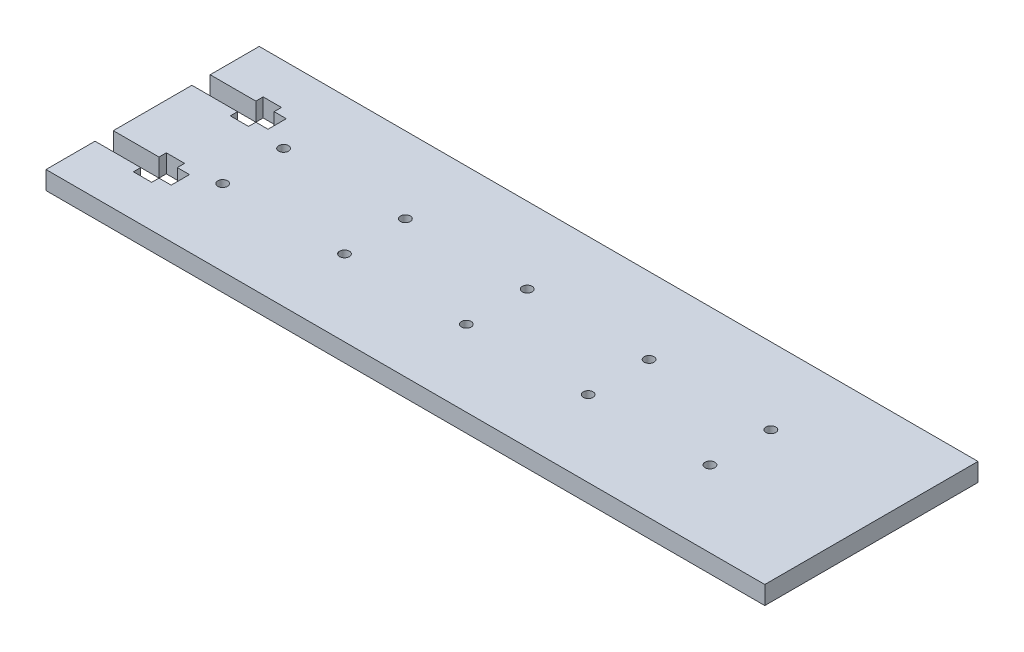
from build123d import *

# Parameters (mm, degrees)
SKETCH1_W           = 236
SKETCH1_H           = 70
SKETCH1_R           = 1.6
BOSS_EXTRUDE1_DEPTH = 6
CUT_EXTRUDE2_DEPTH  = 124.227432011


with BuildPart() as part:
    # Sketch1 → Boss-Extrude1 (new body)
    with BuildSketch(Plane(origin=(0, 0, 0), x_dir=(1, 0, 0), z_dir=(0, 1, 0))):
        Rectangle(SKETCH1_W, SKETCH1_H)
        with Locations((75, -10)):
            Circle(SKETCH1_R, mode=Mode.SUBTRACT)
        with Locations((75, 10)):
            Circle(SKETCH1_R, mode=Mode.SUBTRACT)
        with Locations((35, -10)):
            Circle(SKETCH1_R, mode=Mode.SUBTRACT)
        with Locations((35, 10)):
            Circle(SKETCH1_R, mode=Mode.SUBTRACT)
        with Locations((-5, -10)):
            Circle(SKETCH1_R, mode=Mode.SUBTRACT)
        with Locations((-5, 10)):
            Circle(SKETCH1_R, mode=Mode.SUBTRACT)
        with Locations((-45, -10)):
            Circle(SKETCH1_R, mode=Mode.SUBTRACT)
        with Locations((-45, 10)):
            Circle(SKETCH1_R, mode=Mode.SUBTRACT)
        with Locations((-85, -10)):
            Circle(SKETCH1_R, mode=Mode.SUBTRACT)
        with Locations((-85, 10)):
            Circle(SKETCH1_R, mode=Mode.SUBTRACT)
    extrude(amount=BOSS_EXTRUDE1_DEPTH)

    # Sketch3 → Cut-Extrude2 (cut, through all)
    with BuildSketch(Plane(origin=(0, 6, 0), x_dir=(1, 0, 0), z_dir=(0, 1, 0))):
        Polygon((-118, 12.9), (-103, 12.9), (-103, 10.5), (-97, 10.5), (-97, 12.9), (-93, 12.9), (-93, 18.9), (-97, 18.9), (-97, 21.3), (-103, 21.3), (-103, 18.9), (-118, 18.9), align=None)
        Polygon((-103, -18.9), (-103, -21.3), (-97, -21.3), (-97, -18.9), (-93, -18.9), (-93, -12.9), (-97, -12.9), (-97, -10.5), (-103, -10.5), (-103, -12.9), (-118, -12.9), (-118, -18.9), align=None)
    extrude(amount=-CUT_EXTRUDE2_DEPTH, mode=Mode.SUBTRACT)


solid = part.part
